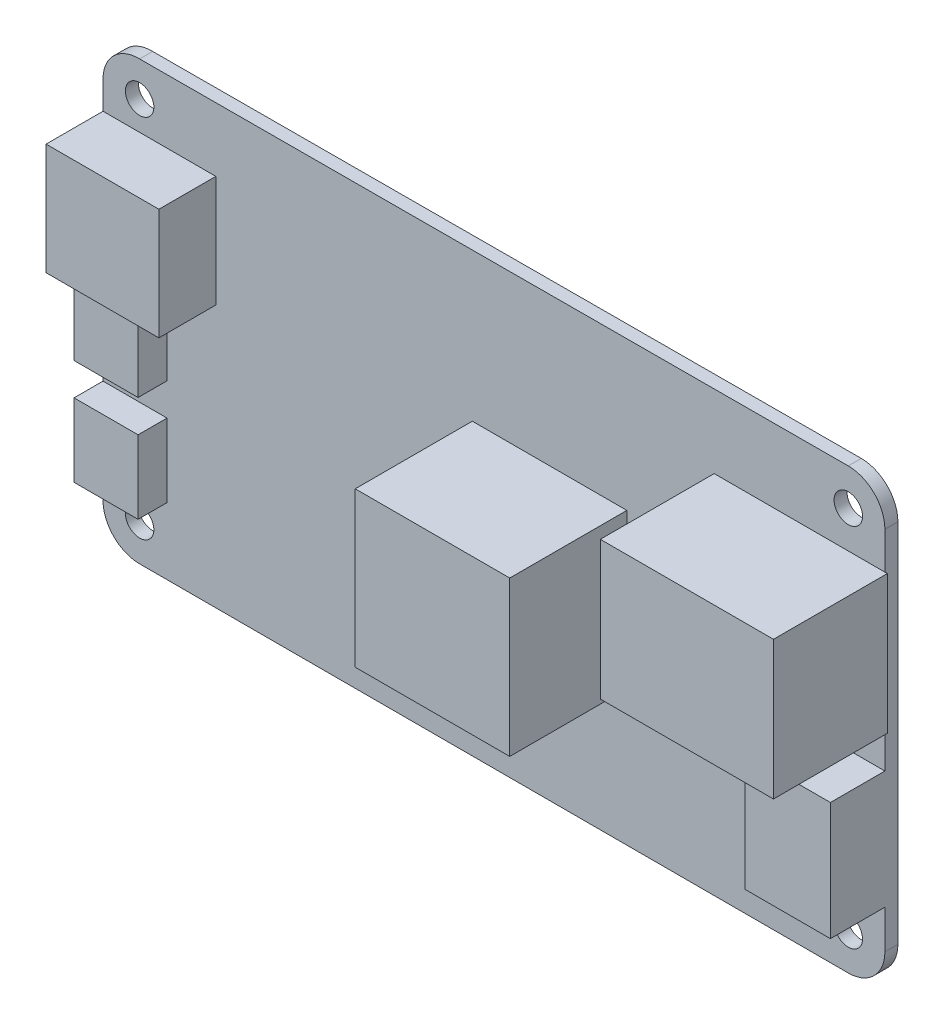
from build123d import *

# Parameters (mm, degrees)
PCB_R              = 1.75
BOARD_DEPTH        = 1.6
GIGE_W             = 21.29
GIGE_H             = 17.01
ETHERNETPORT_DEPTH = 14
HDMI_W             = 10.5
HDMI_H             = 14.5
HDMIPORT_DEPTH     = 6.7
SKETCH9_W          = 19
SKETCH9_H          = 19
FPGAANDFAN_DEPTH   = 14.4
SKETCH10_W         = 7.87
SKETCH10_H         = 9
USBC_DEPTH         = 3.56
SKETCH11_W         = 13.87
SKETCH11_H         = 13.7
USBA_DEPTH         = 7


with BuildPart() as part:
    # pcb → board (new body)
    with BuildSketch(Plane.XY.offset(-31.428393775)):
        with BuildLine():
            Line((91.850829578, -91.451333311), (91.850829578, -136.451333311))
            ThreePointArc((91.850829578, -136.451333311), (90.532810093, -139.633313826), (87.350829578, -140.951333311))
            Line((87.350829578, -140.951333311), (0.210829578, -140.951333311))
            ThreePointArc((0.210829578, -140.951333311), (-2.971150937, -139.633313826), (-4.289170422, -136.451333311))
            Line((-4.289170422, -136.451333311), (-4.289170422, -91.451333311))
            ThreePointArc((-4.289170422, -91.451333311), (-2.923602921, -88.384143861), (0.210829578, -87.180915442))
            Line((0.210829578, -87.180915442), (87.350829578, -86.951333311))
            ThreePointArc((87.350829578, -86.951333311), (90.532810093, -88.269352795), (91.850829578, -91.451333311))
        make_face()
        with Locations((87.350829578, -136.451333311)):
            Circle(PCB_R, mode=Mode.SUBTRACT)
        with Locations((87.350829578, -91.451333311)):
            Circle(PCB_R, mode=Mode.SUBTRACT)
        with Locations((0.210829578, -91.451333311)):
            Circle(PCB_R, mode=Mode.SUBTRACT)
        with Locations((0.210829578, -136.451333311)):
            Circle(PCB_R, mode=Mode.SUBTRACT)
    extrude(amount=BOARD_DEPTH)

    # gige → ethernetport (add)
    with BuildSketch(Plane.XY.offset(-29.828393775)):
        with Locations((81.505829578, -104.516333311)):
            Rectangle(GIGE_W, GIGE_H)
    extrude(amount=ETHERNETPORT_DEPTH)

    # hdmi → hdmiport (add)
    with BuildSketch(Plane.XY.offset(-29.828393775)):
        with Locations((86.600829578, -124.441333311)):
            Rectangle(HDMI_W, HDMI_H)
    extrude(amount=HDMIPORT_DEPTH)

    # Sketch9 → FPGAandFan (add)
    with BuildSketch(Plane.XY.offset(-29.828393775)):
        with Locations((50.620829578, -114.802468161)):
            Rectangle(SKETCH9_W, SKETCH9_H)
    extrude(amount=FPGAANDFAN_DEPTH)

    # Sketch10 → usbc (add)
    with BuildSketch(Plane.XY.offset(-29.828393775)):
        with Locations((-0.354170422, -115.271333311)):
            Rectangle(SKETCH10_W, SKETCH10_H)
        with Locations((-0.354170422, -128.241333311)):
            Rectangle(SKETCH10_W, SKETCH10_H)
    extrude(amount=USBC_DEPTH)

    # Sketch11 → USBA (add)
    with BuildSketch(Plane.XY.offset(-29.828393775)):
        with Locations((2.645829578, -101.850915442)):
            Rectangle(SKETCH11_W, SKETCH11_H)
    extrude(amount=USBA_DEPTH)


solid = part.part
